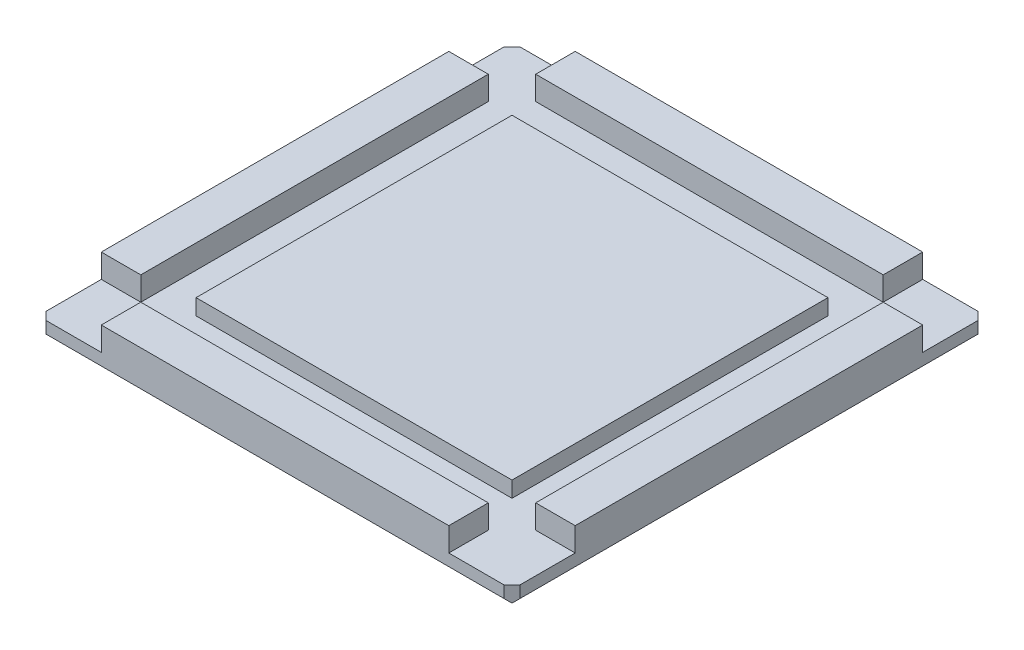
from build123d import *

# Parameters (mm, degrees)
SKETCH_1_W      = 6
SKETCH_1_H      = 6
EXTRUDE_1_DEPTH = 0.2
SKETCH_2_W      = 4
SKETCH_2_H      = 4
EXTRUDE_2_DEPTH = 0.2
SKETCH_3_W      = 0.5
SKETCH_3_H      = 4.4
SKETCH_3_W_2    = 4.4
SKETCH_3_H_2    = 0.5
EXTRUDE_3_DEPTH = 0.3
CHAMFER_1_SIZE  = 0.05
CHAMFER_2_SIZE  = 0.1


with BuildPart() as part:
    # 草图1 → 凸台-拉伸1 (new body)
    with BuildSketch(Plane(origin=(0, 0, 0), x_dir=(1, 0, 0), z_dir=(0, 1, 0))):
        Rectangle(SKETCH_1_W, SKETCH_1_H)
    extrude(amount=EXTRUDE_1_DEPTH)

    # 草图2 → 凸台-拉伸2 (add)
    with BuildSketch(Plane(origin=(0, 0.2, 0), x_dir=(1, 0, 0), z_dir=(0, 1, 0))):
        Rectangle(SKETCH_2_W, SKETCH_2_H)
    extrude(amount=EXTRUDE_2_DEPTH)

    # 草图3 → 凸台-拉伸3 (add)
    with BuildSketch(Plane(origin=(0, 0.2, 0), x_dir=(1, 0, 0), z_dir=(0, 1, 0))):
        with Locations((-2.75, 0)):
            Rectangle(SKETCH_3_W, SKETCH_3_H)
        with Locations((0, -2.75)):
            Rectangle(SKETCH_3_W_2, SKETCH_3_H_2)
        with Locations((2.75, 0)):
            Rectangle(SKETCH_3_W, SKETCH_3_H)
        with Locations((0, 2.75)):
            Rectangle(SKETCH_3_W_2, SKETCH_3_H_2)
    extrude(amount=EXTRUDE_3_DEPTH)

    # 倒角1
    chamfer_1_edges = [part.edges().sort_by_distance(p)[0] for p in [
        (0, 0, 3),
        (-3, 0, 0),
        (0, 0, -3),
        (3, 0, 0),
    ]]
    chamfer(chamfer_1_edges, length=CHAMFER_1_SIZE)

    # 倒角2
    chamfer_2_edges = [part.edges().sort_by_distance(p)[0] for p in [
        (3, 0.125, 3),
        (3, 0.125, -3),
        (-3, 0.125, -3),
        (-3, 0.125, 3),
    ]]
    chamfer(chamfer_2_edges, length=CHAMFER_2_SIZE - 0.0001)  # a hair under: the kernel refuses the full size


solid = part.part
